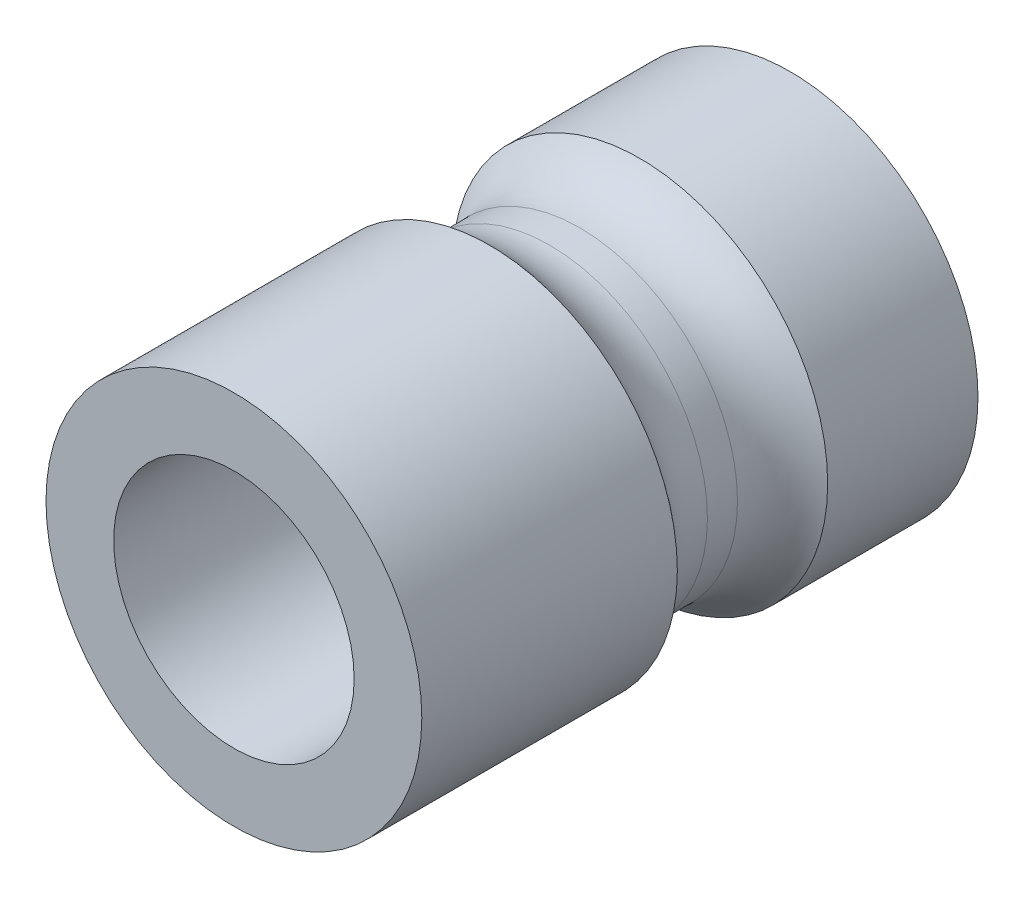
from build123d import *

# Parameters (mm, degrees)
SKETCH_1_R          = 2.5
EXTRUDE_1_DEPTH     = 2
SKETCH_2_R          = 2.1
EXTRUDE_2_DEPTH     = 2
SKETCH_3_R          = 2.5
EXTRUDE_3_DEPTH     = 3.4
SKETCH_4_R          = 1.6
CUT_EXTRUDE_1_DEPTH = 9.201219422
FILLET_1_R          = 1


with BuildPart() as part:
    # Эскиз1 → Бобышка-Вытянуть1 (new body)
    with BuildSketch(Plane.XY):
        Circle(SKETCH_1_R)
    extrude(amount=EXTRUDE_1_DEPTH)

    # Эскиз2 → Бобышка-Вытянуть2 (add)
    with BuildSketch(Plane.XY.offset(2)):
        Circle(SKETCH_2_R)
    extrude(amount=EXTRUDE_2_DEPTH)

    # Эскиз3 → Бобышка-Вытянуть3 (add)
    with BuildSketch(Plane.XY.offset(4)):
        Circle(SKETCH_3_R)
    extrude(amount=EXTRUDE_3_DEPTH)

    # Эскиз4 → Вырез-Вытянуть1 (cut, through all)
    with BuildSketch(Plane.XY.offset(7.4)):
        Circle(SKETCH_4_R)
    extrude(amount=-CUT_EXTRUDE_1_DEPTH, mode=Mode.SUBTRACT)

    # Скругление1
    # the kernel refuses this fillet: 1 mm, written as the material it adds along each edge
    with BuildSketch(Plane(origin=(0, 0, 2), x_dir=(1, 0, 0), z_dir=(0, -1, 0))) as fillet_1_piece_1:
        with BuildLine():
            CenterArc((3.1, 0.8), FILLET_1_R, 180, 53.130102354)
            Line((2.5, 0), (2.488, -0.016))
            ThreePointArc((2.488, -0.016), (2.3, -0.02), (2.1, -0.02))
            Line((2.1, -0.02), (2.08, 0))
            Line((2.08, 0), (2.08, 0.8))
            Line((2.08, 0.8), (2.1, 0.8))
        make_face()
    revolve(axis=Axis((0, 0, 2), (0, 0, 1)))
    with BuildSketch(Plane(origin=(0, 0, 4), x_dir=(1, 0, 0), z_dir=(0, -1, 0))) as fillet_1_piece_2:
        with BuildLine():
            CenterArc((3.1, -0.8), FILLET_1_R, 126.869897646, 53.130102354)
            Line((2.1, -0.8), (2.08, -0.8))
            Line((2.08, -0.8), (2.08, 0))
            Line((2.08, 0), (2.1, 0.02))
            ThreePointArc((2.1, 0.02), (2.3, 0.02), (2.488, 0.016))
            Line((2.488, 0.016), (2.5, 0))
        make_face()
    revolve(axis=Axis((0, 0, 4), (0, 0, 1)))


solid = part.part
